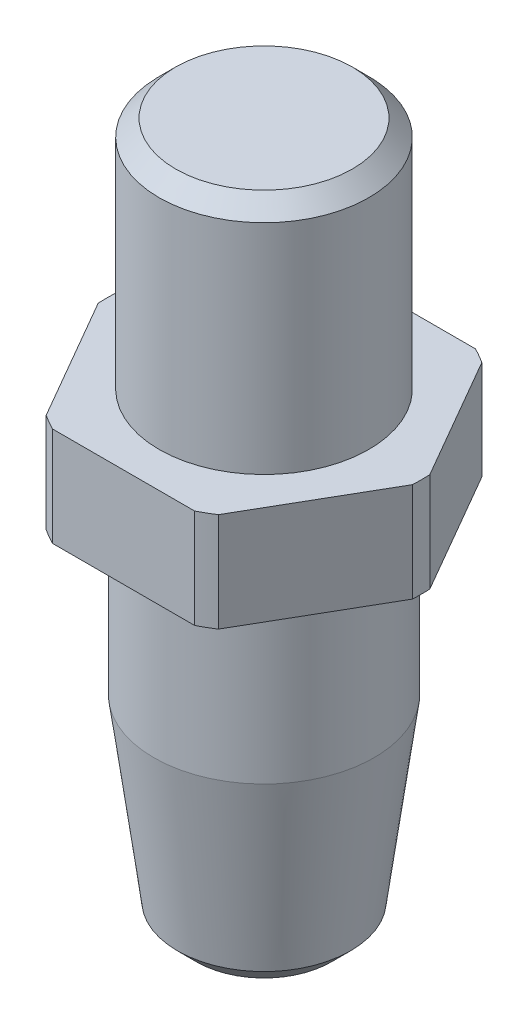
from build123d import *
from OCP.BRepFilletAPI import BRepFilletAPI_MakeChamfer

# Parameters (mm, degrees)
CHAMFER1_SIZE      = 1
CHAMFER1_SIZE2     = 1.162501902
SKETCH4_OUTSIDE_W  = 31.064
SKETCH4_OUTSIDE_H  = 31.064
CUT_EXTRUDE3_DEPTH = 26.796341795


with BuildPart() as part:
    # Sketch1 → Revolve1 (revolve)
    with BuildSketch(Plane.XY):
        Polygon((-6.6675, 0), (-9.525, 0), (-9.525, 6), (-6.35, 6), (-6.35, 20.2), (0, 20.2), (0, -22), (-5.08, -22), (-6.6675, -10), align=None)
    revolve(axis=Axis((0, 72.046513776, 0), (0, -1, 0)))

    # Chamfer1: one chamfer whose edges measure the first distance from different faces: ONE call of the kernel's chamfer builder (chamfer() names one face for all edges)
    chamfer1_edges_1 = [part.edges().sort_by_distance(p)[0] for p in [
        (6.35, 20.2, 0),
    ]]
    chamfer1_edges_2 = [part.edges().sort_by_distance(p)[0] for p in [
        (5.08, -22, 0),
    ]]
    chamfer1_side_2 = [part.faces().sort_by_distance(p)[0] for p in [
        (0, -22, 0),
    ]]
    chamfer1 = BRepFilletAPI_MakeChamfer(part.part.solid().wrapped)
    for e in chamfer1_edges_1:
        chamfer1.Add(CHAMFER1_SIZE, e.wrapped)
    for e in chamfer1_edges_2:
        chamfer1.Add(CHAMFER1_SIZE, CHAMFER1_SIZE2, e.wrapped, chamfer1_side_2[0].wrapped)  # the first distance lies on this face
    add(Compound.cast(chamfer1.Shape()), mode=Mode.REPLACE)

    # Sketch4 outside → Cut-Extrude3 (cut, through all)
    with BuildSketch(Plane(origin=(0, 0, 0), x_dir=(1, 0, 0), z_dir=(0, 1, 0))):
        Rectangle(SKETCH4_OUTSIDE_W, SKETCH4_OUTSIDE_H)
        Polygon((9.814954576, 0), (4.907477288, 8.5), (-4.907477288, 8.5), (-9.814954576, 0), (-4.907477288, -8.5), (4.907477288, -8.5), align=None, mode=Mode.SUBTRACT)
    extrude(amount=CUT_EXTRUDE3_DEPTH, mode=Mode.SUBTRACT)


solid = part.part
